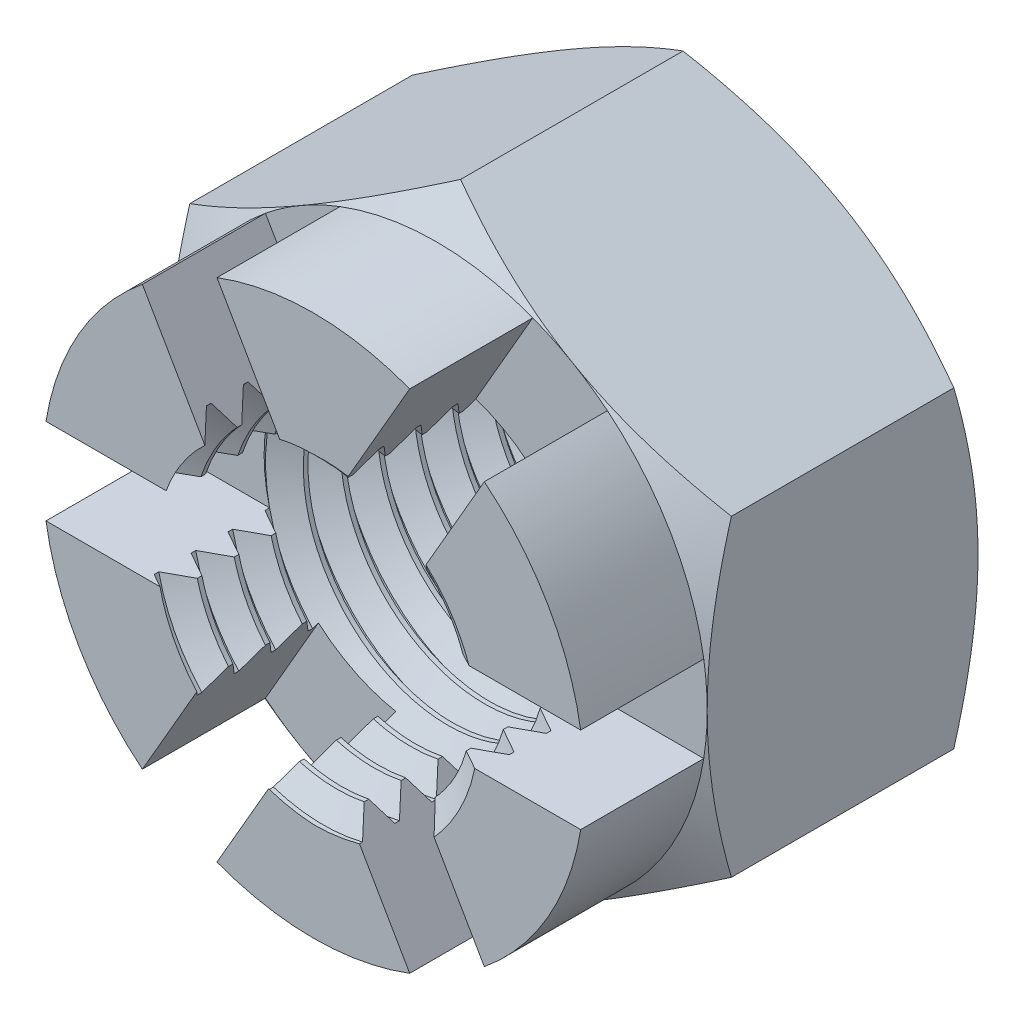
from build123d import *

# Parameters (mm, degrees)
EXTRUDE1_DEPTH      = 16
SKETCH3_OUTSIDE_W   = 115.282
SKETCH3_OUTSIDE_H   = 118.686
SKETCH3_OUTSIDE_R   = 11
CUT_EXTRUDE2_DEPTH  = 24.202011407
CUT_EXTRUDE2_DRAFT  = -60
SKETCH4_R           = 7
CUT_EXTRUDE3_DEPTH  = 24.202011407
CUT_EXTRUDE8_DEPTH  = 5
SKETCH14_OUTSIDE_W  = 104.478
SKETCH14_OUTSIDE_H  = 107.882
SKETCH14_OUTSIDE_R  = 11
CUT_EXTRUDE9_DEPTH  = 21.083160442
CUT_EXTRUDE9_DRAFT  = -60
SKETCH15_OUTSIDE_W  = 31.444
SKETCH15_OUTSIDE_H  = 34.848
SKETCH15_OUTSIDE_R  = 11
CUT_EXTRUDE10_DEPTH = 5
CIRPATTERN2_COUNT   = 6
SKETCH12_R          = 7
SKETCH12_R_2        = 6.025721421
EXTRUDE2_DEPTH      = 16
CUT_SWEEP1_PITCH    = 1.5
BOSS_EXTRUDE1_START = -0.1
SKETCH16_R          = 7.1
SKETCH16_R_2        = 7
BOSS_EXTRUDE1_DEPTH = 0.1
CUT_EXTRUDE11_DEPTH = 5
CIRPATTERN3_COUNT   = 6


with BuildPart() as part:
    # Sketch1 → Extrude1 (new body)
    with BuildSketch(Plane.XY):
        Polygon((0, 12.701705922), (-11, 6.350852961), (-11, -6.350852961), (0, -12.701705922), (11, -6.350852961), (11, 6.350852961), align=None)
    extrude(amount=-EXTRUDE1_DEPTH)


with BuildPart() as cut_extrude2_tool:
    # Sketch3 outside → Cut-Extrude2 (with draft: the straight prism first)
    with BuildSketch(Plane(origin=(0, 0, -16), x_dir=(-1, 0, 0), z_dir=(0, 0, -1))):
        Rectangle(SKETCH3_OUTSIDE_W, SKETCH3_OUTSIDE_H)
        Circle(SKETCH3_OUTSIDE_R, mode=Mode.SUBTRACT)
    extrude(amount=-CUT_EXTRUDE2_DEPTH)
    # Cut-Extrude2: the draft: its side faces are tilted about the plane it starts from
    cut_extrude2_sides = [cut_extrude2_tool.faces().sort_by_distance(p)[0] for p in [
        (0, -59.343, -3.898994296),
        (-57.641, 0, -3.898994296),
        (0, 59.343, -3.898994296),
        (57.641, 0, -3.898994296),
        (11, 0, -3.898994296),
    ]]
    draft(cut_extrude2_sides, Plane(origin=(0, 0, -16), x_dir=(-1, 0, 0), z_dir=(0, 0, -1)), CUT_EXTRUDE2_DRAFT)


with BuildPart() as part_1:
    add(part.part)

    # Cut-Extrude2: cut by cut_extrude2_tool
    add(cut_extrude2_tool.part, mode=Mode.SUBTRACT)

    # Sketch4 → Cut-Extrude3 (cut, through all)
    with BuildSketch(Plane.XY):
        Circle(SKETCH4_R)
    extrude(amount=-CUT_EXTRUDE3_DEPTH, mode=Mode.SUBTRACT)

    # Sketch13 → Cut-Extrude8 (cut)
    with BuildSketch(Plane.XY):
        Polygon((-1.515544457, 0.875), (1.515544457, -0.875), (7.015544457, 8.651279442), (3.984455543, 10.401279442), align=None)
    cut_extrude8 = extrude(amount=-CUT_EXTRUDE8_DEPTH, mode=Mode.SUBTRACT)


with BuildPart() as cut_extrude9_tool:
    # Sketch14 outside → Cut-Extrude9 (with draft: the straight prism first)
    with BuildSketch(Plane.XY.offset(-5)):
        Rectangle(SKETCH14_OUTSIDE_W, SKETCH14_OUTSIDE_H)
        Circle(SKETCH14_OUTSIDE_R, mode=Mode.SUBTRACT)
    extrude(amount=-CUT_EXTRUDE9_DEPTH)
    # Cut-Extrude9: the draft: its side faces are tilted about the plane it starts from
    cut_extrude9_sides = [cut_extrude9_tool.faces().sort_by_distance(p)[0] for p in [
        (0, -53.941, -15.541580221),
        (52.239, 0, -15.541580221),
        (0, 53.941, -15.541580221),
        (-52.239, 0, -15.541580221),
        (-11, 0, -15.541580221),
    ]]
    draft(cut_extrude9_sides, Plane.XY.offset(-5), CUT_EXTRUDE9_DRAFT)


with BuildPart() as part_2:
    add(part_1.part)

    # Cut-Extrude9: cut by cut_extrude9_tool
    add(cut_extrude9_tool.part, mode=Mode.SUBTRACT)

    # Sketch15 outside → Cut-Extrude10 (cut)
    with BuildSketch(Plane.XY):
        Rectangle(SKETCH15_OUTSIDE_W, SKETCH15_OUTSIDE_H)
        Circle(SKETCH15_OUTSIDE_R, mode=Mode.SUBTRACT)
    extrude(amount=-CUT_EXTRUDE10_DEPTH, mode=Mode.SUBTRACT)

    # CirPattern2: Cut-Extrude8 ×6 about axis
    cirpattern2_axis = Axis((0, 0, 0), (0, 0, 1))
    for i in range(1, CIRPATTERN2_COUNT):
        add(cut_extrude8.rotate(cirpattern2_axis, i * 360 / CIRPATTERN2_COUNT), mode=Mode.SUBTRACT)



with BuildPart() as body_2:
    # Sketch12 → Extrude2 (new body)
    with BuildSketch(Plane.XY):
        Circle(SKETCH12_R)
        Circle(SKETCH12_R_2, mode=Mode.SUBTRACT)
    extrude(amount=-EXTRUDE2_DEPTH)

    # Cut-Sweep1: the profile of Sketch9 profile screwed along a right-hand helix of 11.666667 turns, 6 arcs to a turn; built about Z, then put on its axis
    cut_sweep1_z = Axis((0, 0, 0), (0, 0, 1))
    cut_sweep1_corners = [(7.0003, 0, -0.749826795), (7.0003, 0, -0.562673205), (6.025721421, 0, 0), (6.025721421, 0, -1.3125)]
    with BuildLine(mode=Mode.PRIVATE) as cut_sweep1_profile:
        Line(cut_sweep1_corners[0], cut_sweep1_corners[1])
        Line(cut_sweep1_corners[1], cut_sweep1_corners[2])
        Line(cut_sweep1_corners[2], cut_sweep1_corners[3])
        Line(cut_sweep1_corners[3], cut_sweep1_corners[0])
    cut_sweep1_cap = Face(cut_sweep1_profile.wire())
    cut_sweep1_turn_angles = [0, 30, 60, 90, 120, 150, 180, 210, 240, 270, 300, 330, 360]
    cut_sweep1_turn_weights = [1, 0.8660254037844387, 1, 0.8660254037844387, 1, 0.8660254037844387, 1, 0.8660254037844387, 1, 0.8660254037844387, 1, 0.8660254037844387, 1]
    cut_sweep1_turn_rails = [Edge.make_bspline([Vector(p[0], p[1], 0).rotate(cut_sweep1_z, cut_sweep1_turn_angles[k]) / cut_sweep1_turn_weights[k] + Vector(0, 0, p[2] + CUT_SWEEP1_PITCH * cut_sweep1_turn_angles[k] / 360) for k in range(13)], [0, 0, 0, 1, 1, 2, 2, 3, 3, 4, 4, 5, 5, 6, 6, 6], 2, cut_sweep1_turn_weights) for p in cut_sweep1_corners]
    cut_sweep1_turn_sides = [Face.make_surface_from_curves(cut_sweep1_turn_rails[p[0]], cut_sweep1_turn_rails[p[1]]) for p in [(0, 1), (1, 2), (2, 3), (3, 0)]]
    cut_sweep1_last_angles = [3960, 3990, 4020, 4050, 4080, 4110, 4140, 4170, 4200]
    cut_sweep1_last_weights = [1, 0.8660254037844387, 1, 0.8660254037844387, 1, 0.8660254037844387, 1, 0.8660254037843236, 1]
    cut_sweep1_last_rails = [Edge.make_bspline([Vector(p[0], p[1], 0).rotate(cut_sweep1_z, cut_sweep1_last_angles[k]) / cut_sweep1_last_weights[k] + Vector(0, 0, p[2] + CUT_SWEEP1_PITCH * cut_sweep1_last_angles[k] / 360) for k in range(9)], [0, 0, 0, 1, 1, 2, 2, 3, 3, 4, 4, 4], 2, cut_sweep1_last_weights) for p in cut_sweep1_corners]
    cut_sweep1_last_sides = [Face.make_surface_from_curves(cut_sweep1_last_rails[p[0]], cut_sweep1_last_rails[p[1]]) for p in [(0, 1), (1, 2), (2, 3), (3, 0)]]
    cut_sweep1 = Plane(origin=(0, 0, 0), x_dir=(0, 1, 0), z_dir=(0, 0, -1)) * Solid(Shell([*[p.moved(Location((0, 0, CUT_SWEEP1_PITCH * i))) for i in range(11) for p in cut_sweep1_turn_sides], *cut_sweep1_last_sides, cut_sweep1_cap, cut_sweep1_cap.rotate(cut_sweep1_z, 4200).moved(Location((0, 0, CUT_SWEEP1_PITCH * 4200 / 360)))]))
    add(cut_sweep1, mode=Mode.SUBTRACT)


with BuildPart() as part_3:
    add(part_2.part)

    add(body_2.part)  # Boss-Extrude1 merges body 2
    # Sketch16 → Boss-Extrude1 (add)
    with BuildSketch(Plane(origin=(0, 0, -16), x_dir=(-1, 0, 0), z_dir=(0, 0, -1)).offset(BOSS_EXTRUDE1_START)):
        Circle(SKETCH16_R)
        Circle(SKETCH16_R_2, mode=Mode.SUBTRACT)
    extrude(amount=BOSS_EXTRUDE1_DEPTH)

    # Sketch17 → Cut-Extrude11 (cut)
    with BuildSketch(Plane.XY):
        Polygon((-1.515544457, 0.875), (1.515544457, -0.875), (7.015544457, 8.651279442), (3.984455543, 10.401279442), align=None)
    cut_extrude11 = extrude(amount=-CUT_EXTRUDE11_DEPTH, mode=Mode.SUBTRACT)

    # CirPattern3: Cut-Extrude11 ×6 about axis
    cirpattern3_axis = Axis((0, 0, -35.798989873), (0, 0, 1))
    for i in range(1, CIRPATTERN3_COUNT):
        add(cut_extrude11.rotate(cirpattern3_axis, i * 360 / CIRPATTERN3_COUNT), mode=Mode.SUBTRACT)


solid = part_3.part
